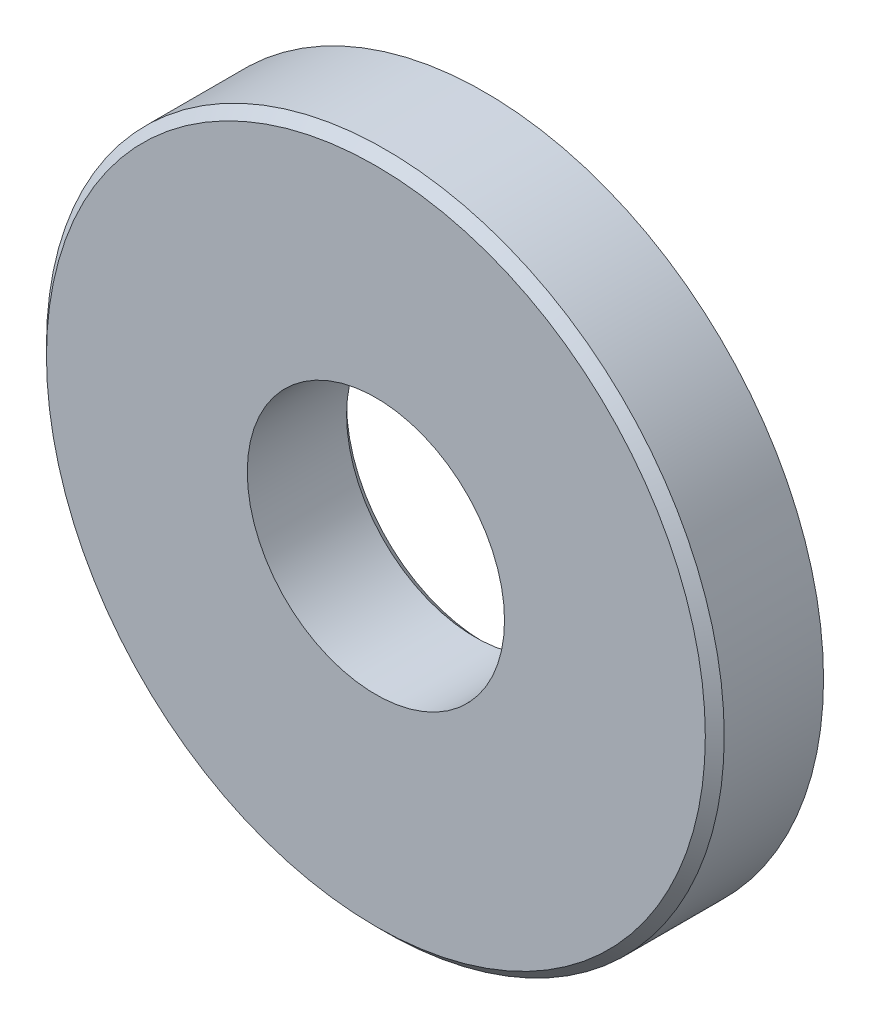
from build123d import *

# Parameters (mm, degrees)
SKETCH_1_R      = 10.75
SKETCH_1_R_2    = 4.08
EXTRUDE_1_DEPTH = 3.45
CHAMFER_1_SIZE  = 0.3
CHAMFER_2_SIZE  = 0.3


with BuildPart() as part:
    # 草图1 → 凸台-拉伸1 (new body)
    with BuildSketch(Plane.XY):
        Circle(SKETCH_1_R)
        Circle(SKETCH_1_R_2, mode=Mode.SUBTRACT)
    extrude(amount=EXTRUDE_1_DEPTH)

    # 倒角1
    chamfer_1_edges = [part.edges().sort_by_distance(p)[0] for p in [
        (-10.75, 0, 3.45),
    ]]
    chamfer(chamfer_1_edges, length=CHAMFER_1_SIZE)

    # 倒角2
    chamfer_2_edges = [part.edges().sort_by_distance(p)[0] for p in [
        (-4.08, 0, 0),
    ]]
    chamfer(chamfer_2_edges, length=CHAMFER_2_SIZE)


solid = part.part
